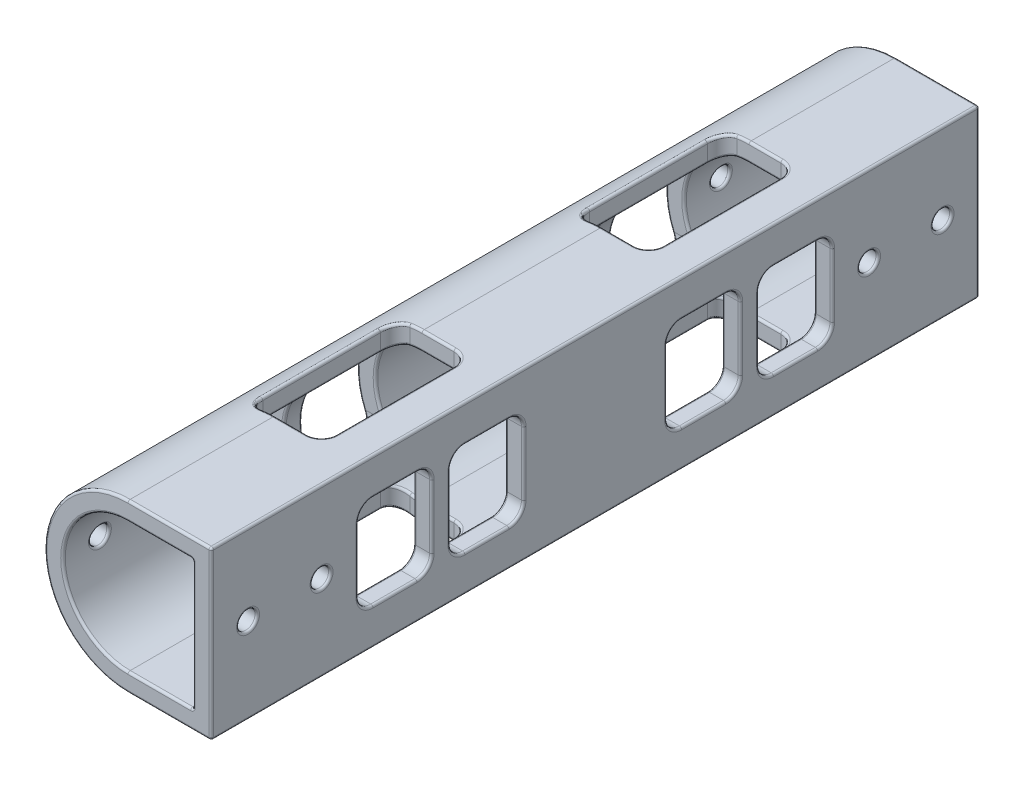
from build123d import *

# Parameters (mm, degrees)
BOSS_EXTRUDE1_DEPTH     = 132.682869
CUT_EXTRUDE1_DEPTH      = 25.4
CUT_EXTRUDE1_DEPTH_BACK = 25.4
CUT_EXTRUDE2_DEPTH      = 25.4
CUT_EXTRUDE2_DEPTH_BACK = 25.4
CUT_EXTRUDE3_DEPTH      = 25.4
CUT_EXTRUDE3_DEPTH_BACK = 25.4
SKETCH7_R               = 1.5875
FILLET3_R               = 0.396875
FILLET4_R               = 0.396875


with BuildPart() as part:
    # Sketch1 → Boss-Extrude1 (new body)
    with BuildSketch(Plane.XY):
        with BuildLine():
            Line((0, 10.804196024), (0, 13.979196024))
            ThreePointArc((0, 13.979196024), (-14.39545, -0.416253976), (0, -14.811703976))
            Line((0, -14.811703976), (0, -11.636703976))
            ThreePointArc((0, -11.636703976), (-11.22045, -0.416253976), (0, 10.804196024))
        make_face()
        Polygon((14.39545, 13.979196024), (0, 13.979196024), (0, 10.804196024), (11.22045, 10.804196024), (11.22045, -11.636703976), (0, -11.636703976), (0, -14.811703976), (14.39545, -14.811703976), align=None)
    extrude(amount=BOSS_EXTRUDE1_DEPTH)

    # Sketch3 → Cut-Extrude1 (cut, two sides: drawn at the far end of the back side and taken through both)
    with BuildSketch(Plane(origin=(0, 0, 0), x_dir=(0, 0, -1), z_dir=(1, 0, 0)).offset(-CUT_EXTRUDE1_DEPTH_BACK)):
        with BuildLine():
            Line((-104.742869, -8.461703976), (-97.122869, -8.461703976))
            ThreePointArc((-97.122869, -8.461703976), (-95.326817776, -7.7177552), (-94.582869, -5.921703976))
            Line((-94.582869, -5.921703976), (-94.582869, 5.089196024))
            ThreePointArc((-94.582869, 5.089196024), (-95.326817776, 6.885247248), (-97.122869, 7.629196024))
            Line((-97.122869, 7.629196024), (-104.742869, 7.629196024))
            ThreePointArc((-104.742869, 7.629196024), (-106.538920224, 6.885247248), (-107.282869, 5.089196024))
            Line((-107.282869, 5.089196024), (-107.282869, -5.921703976))
            ThreePointArc((-107.282869, -5.921703976), (-106.538920224, -7.7177552), (-104.742869, -8.461703976))
        make_face()
        with BuildLine():
            Line((-88.867869, -8.461703976), (-81.247869, -8.461703976))
            ThreePointArc((-81.247869, -8.461703976), (-79.451817776, -7.7177552), (-78.707869, -5.921703976))
            Line((-78.707869, -5.921703976), (-78.707869, 5.089196024))
            ThreePointArc((-78.707869, 5.089196024), (-79.451817776, 6.885247248), (-81.247869, 7.629196024))
            Line((-81.247869, 7.629196024), (-88.867869, 7.629196024))
            ThreePointArc((-88.867869, 7.629196024), (-90.663920224, 6.885247248), (-91.407869, 5.089196024))
            Line((-91.407869, 5.089196024), (-91.407869, -5.921703976))
            ThreePointArc((-91.407869, -5.921703976), (-90.663920224, -7.7177552), (-88.867869, -8.461703976))
        make_face()
        with BuildLine():
            Line((-35.56, -8.461703976), (-27.94, -8.461703976))
            ThreePointArc((-27.94, -8.461703976), (-26.143948776, -7.7177552), (-25.4, -5.921703976))
            Line((-25.4, -5.921703976), (-25.4, 5.089196024))
            ThreePointArc((-25.4, 5.089196024), (-26.143948776, 6.885247248), (-27.94, 7.629196024))
            Line((-27.94, 7.629196024), (-35.56, 7.629196024))
            ThreePointArc((-35.56, 7.629196024), (-37.356051224, 6.885247248), (-38.1, 5.089196024))
            Line((-38.1, 5.089196024), (-38.1, -5.921703976))
            ThreePointArc((-38.1, -5.921703976), (-37.356051224, -7.7177552), (-35.56, -8.461703976))
        make_face()
        with BuildLine():
            Line((-51.435, -8.461703976), (-43.815, -8.461703976))
            ThreePointArc((-43.815, -8.461703976), (-42.018948776, -7.7177552), (-41.275, -5.921703976))
            Line((-41.275, -5.921703976), (-41.275, 5.089196024))
            ThreePointArc((-41.275, 5.089196024), (-42.018948776, 6.885247248), (-43.815, 7.629196024))
            Line((-43.815, 7.629196024), (-51.435, 7.629196024))
            ThreePointArc((-51.435, 7.629196024), (-53.231051224, 6.885247248), (-53.975, 5.089196024))
            Line((-53.975, 5.089196024), (-53.975, -5.921703976))
            ThreePointArc((-53.975, -5.921703976), (-53.231051224, -7.7177552), (-51.435, -8.461703976))
        make_face()
    extrude(amount=CUT_EXTRUDE1_DEPTH + CUT_EXTRUDE1_DEPTH_BACK, mode=Mode.SUBTRACT)

    # Sketch6 → Cut-Extrude2 (cut, two sides: drawn at the far end of the back side and taken through both)
    with BuildSketch(Plane(origin=(0, 0, 0), x_dir=(1, 0, 0), z_dir=(0, 1, 0)).offset(-CUT_EXTRUDE2_DEPTH_BACK)):
        with BuildLine():
            Line((-2.11455, -25.4), (5.50545, -25.4))
            ThreePointArc((5.50545, -25.4), (7.301501224, -26.143948776), (8.04545, -27.94))
            Line((8.04545, -27.94), (8.04545, -48.26))
            ThreePointArc((8.04545, -48.26), (7.301501224, -50.056051224), (5.50545, -50.8))
            Line((5.50545, -50.8), (-2.11455, -50.8))
            ThreePointArc((-2.11455, -50.8), (-3.910601224, -50.056051224), (-4.65455, -48.26))
            Line((-4.65455, -48.26), (-4.65455, -27.94))
            ThreePointArc((-4.65455, -27.94), (-3.910601224, -26.143948776), (-2.11455, -25.4))
        make_face()
        with BuildLine():
            Line((5.50545, -107.282869), (-2.11455, -107.282869))
            ThreePointArc((-2.11455, -107.282869), (-3.910601224, -106.538920224), (-4.65455, -104.742869))
            Line((-4.65455, -104.742869), (-4.65455, -84.422869))
            ThreePointArc((-4.65455, -84.422869), (-3.910601224, -82.626817776), (-2.11455, -81.882869))
            Line((-2.11455, -81.882869), (5.50545, -81.882869))
            ThreePointArc((5.50545, -81.882869), (7.301501224, -82.626817776), (8.04545, -84.422869))
            Line((8.04545, -84.422869), (8.04545, -104.742869))
            ThreePointArc((8.04545, -104.742869), (7.301501224, -106.538920224), (5.50545, -107.282869))
        make_face()
    extrude(amount=CUT_EXTRUDE2_DEPTH + CUT_EXTRUDE2_DEPTH_BACK, mode=Mode.SUBTRACT)

    # Sketch7 → Cut-Extrude3 (cut, two sides: drawn at the far end of the back side and taken through both)
    with BuildSketch(Plane(origin=(0, 0, 0), x_dir=(0, 0, -1), z_dir=(1, 0, 0)).offset(-CUT_EXTRUDE3_DEPTH_BACK)):
        with Locations(Location((-126.332869, 0, 0), (0, 0, 180))):
            Circle(SKETCH7_R)
        with Locations(Location((-113.632869, 0, 0), (0, 0, 180))):
            Circle(SKETCH7_R)
        with Locations(Location((-19.05, 0, 0), (0, 0, 180))):
            Circle(SKETCH7_R)
        with Locations(Location((-6.35, 0, 0), (0, 0, 180))):
            Circle(SKETCH7_R)
    extrude(amount=CUT_EXTRUDE3_DEPTH + CUT_EXTRUDE3_DEPTH_BACK, mode=Mode.SUBTRACT)

    # Fillet3
    fillet3_edges = [part.edges().sort_by_distance(p)[0] for p in [
        (14.39545, -0.416253976, 0),
        (7.197725, -14.811703976, 0),
        (-12.43015713, 6.844611983, 41.979212753),
        (-8.576465417, 6.818574243, 41.954663724),
        (-11.937324449, 7.629196024, 47.625),
        (-7.821076173, 7.629196024, 47.625),
        (5.610225, 10.804196024, 132.682869),
        (-12.430157135, 6.844611991, 53.270787251),
        (-8.576465417, 6.818574243, 53.295336276),
        (-14.39545, -0.416253976, 0),
        (-14.39545, -0.416253976, 53.975),
        (-11.22045, -0.416253976, 53.975),
        (-14.39545, -0.416253976, 53.975),
        (-8.576465417, -7.651082195, 53.295336276),
        (-11.937324449, -8.461703976, 47.625),
        (-7.821076173, -8.461703976, 47.625),
        (-12.43015713, -7.677119935, 41.979212755),
        (-8.576465424, -7.651082188, 41.954663732),
        (-14.39545, -0.416253976, 41.275),
        (-11.22045, -0.416253976, 41.275),
        (11.22045, 6.885247248, 42.018948776),
        (11.22045, 7.629196024, 47.625),
        (7.197725, 13.979196024, 0),
        (11.22045, 6.885247248, 53.231051224),
        (11.22045, -0.416253976, 53.975),
        (11.22045, -7.7177552, 53.231051224),
        (11.22045, -8.461703976, 47.625),
        (11.22045, -7.7177552, 42.018948776),
        (11.22045, -0.416253976, 41.275),
        (5.610225, -11.636703976, 0),
        (11.22045, -0.416253976, 0),
        (5.610225, 10.804196024, 0),
        (-11.22045, -0.416253976, 0),
        (-12.43015713, -7.677119935, 79.412081755),
        (-8.576465424, -7.651082188, 79.387532732),
        (-14.39545, -0.416253976, 78.707869),
        (-11.22045, -0.416253976, 78.707869),
        (-12.43015713, 6.844611983, 79.412081753),
        (-8.576465417, 6.818574243, 79.387532724),
        (-11.937324449, 7.629196024, 85.057869),
        (-7.821076173, 7.629196024, 85.057869),
        (-12.430157135, 6.844611991, 90.703656251),
        (-11.22045, -0.416253976, 91.407869),
        (-14.39545, -0.416253976, 91.407869),
        (-11.22045, -0.416253976, 91.407869),
        (-14.39545, -0.416253976, 91.407869),
        (-8.576465417, -7.651082195, 90.728205276),
        (-11.937324449, -8.461703976, 85.057869),
        (-7.821076173, -8.461703976, 85.057869),
        (11.22045, -7.7177552, 79.451817776),
        (11.22045, -0.416253976, 78.707869),
        (11.22045, 6.885247248, 79.451817776),
        (11.22045, 7.629196024, 85.057869),
        (11.22045, 6.885247248, 90.663920224),
        (11.22045, -0.416253976, 91.407869),
        (11.22045, -7.7177552, 90.663920224),
        (11.22045, -8.461703976, 85.057869),
        (11.22045, -0.416253976, 132.682869),
        (14.39545, 13.979196024, 66.3414345),
        (11.22045, -11.636703976, 66.3414345),
        (11.22045, 10.804196024, 66.3414345),
        (-14.39545, -0.416253976, 38.1),
        (-11.22045, -0.416253976, 38.1),
        (-14.39545, -0.416253976, 38.1),
        (-11.22045, -0.416253976, 38.1),
        (-12.43015713, -7.677119934, 37.395787247),
        (-8.576465417, -7.651082195, 37.420336276),
        (-11.937324449, -8.461703976, 31.75),
        (-7.821076173, -8.461703976, 31.75),
        (-12.43015713, -7.677119935, 26.104212755),
        (-8.576465425, -7.651082188, 26.079663731),
        (-14.39545, -0.416253976, 25.4),
        (-11.22045, -0.416253976, 25.4),
        (-12.430157127, 6.844611984, 26.104212753),
        (-8.576465411, 6.818574229, 26.079663732),
        (-11.937324449, 7.629196024, 31.75),
        (-7.821076173, 7.629196024, 31.75),
        (11.22045, 6.885247248, 37.356051224),
        (11.22045, -0.416253976, 38.1),
        (11.22045, -7.7177552, 37.356051224),
        (11.22045, -8.461703976, 31.75),
        (11.22045, -7.7177552, 26.143948776),
        (11.22045, -0.416253976, 25.4),
        (11.22045, 6.885247248, 26.143948776),
        (11.22045, 7.629196024, 31.75),
        (5.610225, -11.636703976, 132.682869),
        (7.197725, 13.979196024, 132.682869),
        (14.39545, 7.629196024, 31.75),
        (14.39545, 6.885247248, 26.143948776),
        (14.39545, -0.416253976, 25.4),
        (14.39545, -7.7177552, 26.143948776),
        (14.39545, -8.461703976, 31.75),
        (14.39545, -7.7177552, 37.356051224),
        (14.39545, -0.416253976, 38.1),
        (14.39545, 6.885247248, 37.356051224),
        (14.39545, -8.461703976, 85.057869),
        (-14.39545, -0.416253976, 132.682869),
        (14.39545, -7.7177552, 90.663920224),
        (2.752725, -11.636703976, 25.4),
        (7.301501224, -11.636703976, 26.143948776),
        (14.39545, -0.416253976, 91.407869),
        (8.04545, -11.636703976, 38.1),
        (7.301501224, -11.636703976, 50.056051224),
        (2.752725, -11.636703976, 50.8),
        (2.752725, -11.636703976, 81.882869),
        (7.301501224, -11.636703976, 82.626817776),
        (8.04545, -11.636703976, 94.582869),
        (7.301501224, -11.636703976, 106.538920224),
        (2.752725, -11.636703976, 107.282869),
        (14.39545, 6.885247248, 90.663920224),
        (14.39545, 7.629196024, 85.057869),
        (14.39545, 6.885247248, 79.451817776),
        (14.39545, -0.416253976, 78.707869),
        (-4.65455, 9.79323487, 38.1),
        (-1.062043173, 10.753820442, 25.4),
        (-3.899161208, 10.104917066, 50.067418831),
        (-4.65455, -10.625742822, 38.1),
        (14.39545, -7.7177552, 79.451817776),
        (-3.899161195, -10.937424982, 26.132581168),
        (-3.899161208, -10.937425018, 50.067418831),
        (-4.65455, 9.79323487, 94.582869),
        (-1.062043173, 10.753820442, 81.882869),
        (-3.899161209, 10.104917064, 106.550287833),
        (-4.65455, -10.625742822, 94.582869),
        (-3.899161208, -10.937425017, 82.615450169),
        (-3.899161209, -10.937425016, 106.550287833),
        (14.39545, -0.416253976, 41.275),
        (-3.903568138, 13.439832647, 106.545925877),
        (-3.903568138, -14.272340598, 106.545925877),
        (14.39545, -7.7177552, 42.018948776),
        (-3.903568139, 13.439832646, 82.619812125),
        (-1.060153831, -14.772613353, 81.882869),
        (-4.65455, -14.038447081, 94.582869),
        (-4.65455, 13.205939129, 94.582869),
        (2.752725, 10.804196024, 107.282869),
        (2.752725, 13.979196024, 107.282869),
        (-1.060153831, 13.940105401, 107.282869),
        (2.752725, -14.811703976, 107.282869),
        (-1.060153831, -14.772613353, 107.282869),
        (7.301501224, -14.811703976, 106.538920224),
        (14.39545, -8.461703976, 47.625),
        (8.04545, -14.811703976, 94.582869),
        (7.301501224, -14.811703976, 82.626817776),
        (2.752725, 13.979196024, 81.882869),
        (2.752725, 10.804196024, 81.882869),
        (-1.060153831, 13.940105401, 81.882869),
        (-1.060153831, -14.772613353, 81.882869),
        (2.752725, -14.811703976, 81.882869),
        (-1.062043173, 10.753820442, 107.282869),
        (-1.062043173, -11.586328394, 107.282869),
        (7.301501224, 13.979196024, 106.538920224),
        (14.39545, -7.7177552, 53.231051224),
        (7.301501224, 10.804196024, 106.538920224),
        (8.04545, 13.979196024, 94.582869),
        (8.04545, 10.804196024, 94.582869),
        (7.301501224, 13.979196024, 82.626817776),
        (7.301501224, 10.804196024, 82.626817776),
        (-1.062043173, 10.753820442, 81.882869),
        (-1.062043173, -11.586328394, 81.882869),
        (14.39545, -0.416253976, 53.975),
        (7.197725, -14.811703976, 132.682869),
        (14.39545, 6.885247248, 53.231051224),
        (14.39545, 7.629196024, 47.625),
        (14.39545, 6.885247248, 42.018948776),
        (14.39545, -0.416253976, 94.582869),
        (-3.903568139, 13.439832647, 50.063056876),
        (-3.903568139, -14.272340598, 50.063056876),
        (-1.060153831, 13.940105401, 25.4),
        (-1.060153831, -14.772613353, 25.4),
        (14.39545, -7.7177552, 95.326817776),
        (-4.65455, -14.038447081, 38.1),
        (-4.65455, 13.205939129, 38.1),
        (2.752725, 10.804196024, 50.8),
        (2.752725, 13.979196024, 50.8),
        (-1.060153831, 13.940105401, 50.8),
        (2.752725, -14.811703976, 50.8),
        (-1.060153831, -14.772613353, 50.8),
        (7.301501224, -14.811703976, 50.056051224),
        (8.04545, -14.811703976, 38.1),
        (14.39545, -8.461703976, 100.932869),
        (7.301501224, -14.811703976, 26.143948776),
        (2.752725, 13.979196024, 25.4),
        (2.752725, 10.804196024, 25.4),
        (-1.060153831, 13.940105401, 25.4),
        (-1.060153831, -14.772613353, 25.4),
        (2.752725, -14.811703976, 25.4),
        (-1.062043173, 10.753820442, 50.8),
        (-1.062043173, -11.586328394, 50.8),
        (7.301501224, 13.979196024, 50.056051224),
        (7.301501224, 10.804196024, 50.056051224),
        (8.04545, 13.979196024, 38.1),
        (8.04545, 10.804196024, 38.1),
        (7.301501224, 13.979196024, 26.143948776),
        (7.301501224, 10.804196024, 26.143948776),
        (-1.062043173, 10.753820442, 25.4),
        (14.39545, -7.7177552, 106.538920224),
        (-1.062043173, -11.586328394, 25.4),
        (14.39545, -0.416253976, 107.282869),
        (14.39545, 6.885247248, 106.538920224),
        (14.39545, 7.629196024, 100.932869),
        (14.39545, 6.885247248, 95.326817776),
        (-11.212515297, 0.0056452, 4.762510031),
        (-14.38933166, 0.003407852, 4.76250365),
        (11.22045, 0, 4.7625),
        (14.39545, 0, 4.7625),
        (-11.212515297, 0.0056452, 17.462510031),
        (-14.38933166, 0.003407852, 17.46250365),
        (11.22045, 0, 17.4625),
        (14.39545, 0, 17.4625),
        (-14.38933166, 0.003407852, 112.04537265),
        (-11.212515297, 0.0056452, 112.045379031),
        (11.22045, 0, 112.045369),
        (14.39545, 0, 112.045369),
        (-14.38933166, 0.003407852, 124.74537265),
        (-11.212515297, 0.0056452, 124.745379031),
        (11.22045, 0, 124.745369),
        (14.39545, 0, 124.745369),
        (-11.22045, -0.416253976, 132.682869),
        (-12.43015713, 6.844611983, 95.287081753),
        (-8.576465417, 6.818574243, 95.262532724),
        (-11.937324449, 7.629196024, 100.932869),
        (-7.821076173, 7.629196024, 100.932869),
        (-12.430157135, 6.844611991, 106.578656251),
        (-8.576465417, 6.818574243, 106.603205276),
        (-14.39545, -0.416253976, 107.282869),
        (-11.22045, -0.416253976, 107.282869),
        (-14.39545, -0.416253976, 107.282869),
        (-8.576465417, -7.651082195, 106.603205276),
        (-11.937324449, -8.461703976, 100.932869),
        (-7.821076173, -8.461703976, 100.932869),
        (-12.43015713, -7.677119935, 95.287081755),
        (-8.576465424, -7.651082188, 95.262532732),
        (-14.39545, -0.416253976, 94.582869),
        (-11.22045, -0.416253976, 94.582869),
        (11.22045, 6.885247248, 95.326817776),
        (11.22045, 7.629196024, 100.932869),
        (11.22045, 6.885247248, 106.538920224),
        (11.22045, -0.416253976, 107.282869),
        (11.22045, -7.7177552, 106.538920224),
        (11.22045, -8.461703976, 100.932869),
        (11.22045, -7.7177552, 95.326817776),
        (11.22045, -0.416253976, 94.582869),
    ]]
    fillet(fillet3_edges, radius=FILLET3_R)

    # Fillet4
    # the kernel refuses this fillet: 0.396875 mm, written as the material it takes off along each edge
    with BuildSketch(Plane(origin=(13.998575, -14.414828976, 0.396875), x_dir=(0, -1, 0), z_dir=(1, 0, 0))) as fillet4_piece_1_section:
        Polygon((0, 0), (FILLET4_R, 0), (FILLET4_R, FILLET4_R), (0, FILLET4_R), align=None)
    fillet4_piece_1 = extrude(amount=FILLET4_R, mode=Mode.PRIVATE)
    fillet4_piece_1 = fillet4_piece_1 - Plane(origin=(13.998575, -14.414828976, 0.396875), x_dir=(0, 0.7071067811865475, 0.7071067811865475), z_dir=(1, 0, 0)) * Sphere(FILLET4_R, mode=Mode.PRIVATE)
    add(fillet4_piece_1, mode=Mode.SUBTRACT)
    with BuildSketch(Plane(origin=(13.998575, 13.582321024, 132.285994), x_dir=(1, 0, 0), z_dir=(0, 0, 1))) as fillet4_piece_2_section:
        Polygon((0, 0), (FILLET4_R, 0), (FILLET4_R, FILLET4_R), (0, FILLET4_R), align=None)
    fillet4_piece_2 = extrude(amount=FILLET4_R, mode=Mode.PRIVATE)
    fillet4_piece_2 = fillet4_piece_2 - Plane(origin=(13.998575, 13.582321024, 132.285994), x_dir=(-0.7071067811865474, -0.7071067811865477, 0), z_dir=(0, 0, 1)) * Sphere(FILLET4_R, mode=Mode.PRIVATE)
    add(fillet4_piece_2, mode=Mode.SUBTRACT)
    with BuildSketch(Plane(origin=(14.39545, -14.811703976, 0.396875), x_dir=(0, 1, 0), z_dir=(0, 0, 1))) as fillet4_piece_3:
        with BuildLine():
            CenterArc((FILLET4_R, FILLET4_R), FILLET4_R, 180, 90)
            Line((0, FILLET4_R), (0, 0))
            Line((0, 0), (FILLET4_R, 0))
        make_face()
    extrude(amount=131.889119, mode=Mode.SUBTRACT)
    with BuildSketch(Plane(origin=(14.39545, -14.414828976, 132.682869), x_dir=(-1, 0, 0), z_dir=(0, 1, 0))) as fillet4_piece_4:
        with BuildLine():
            CenterArc((FILLET4_R, -FILLET4_R), FILLET4_R, 90, 90)
            Line((0, -FILLET4_R), (0, 0))
            Line((0, 0), (FILLET4_R, 0))
        make_face()
    extrude(amount=27.99715, mode=Mode.SUBTRACT)
    with BuildSketch(Plane(origin=(14.39545, -14.414828976, 132.285994), x_dir=(0, 0, 1), z_dir=(0, 1, 0))) as fillet4_piece_5:
        with BuildLine():
            CenterArc((0.396875 - FILLET4_R, -FILLET4_R), FILLET4_R, 0, 90)
            Line((0.396875, -FILLET4_R), (0.396875, 0))
            Line((0.396875, 0), (0.396875 - FILLET4_R, 0))
        make_face()
    revolve(axis=Axis((14.39545, -14.414828976, 132.285994), (1, 0, 0)), revolution_arc=90, mode=Mode.SUBTRACT)


solid = part.part
